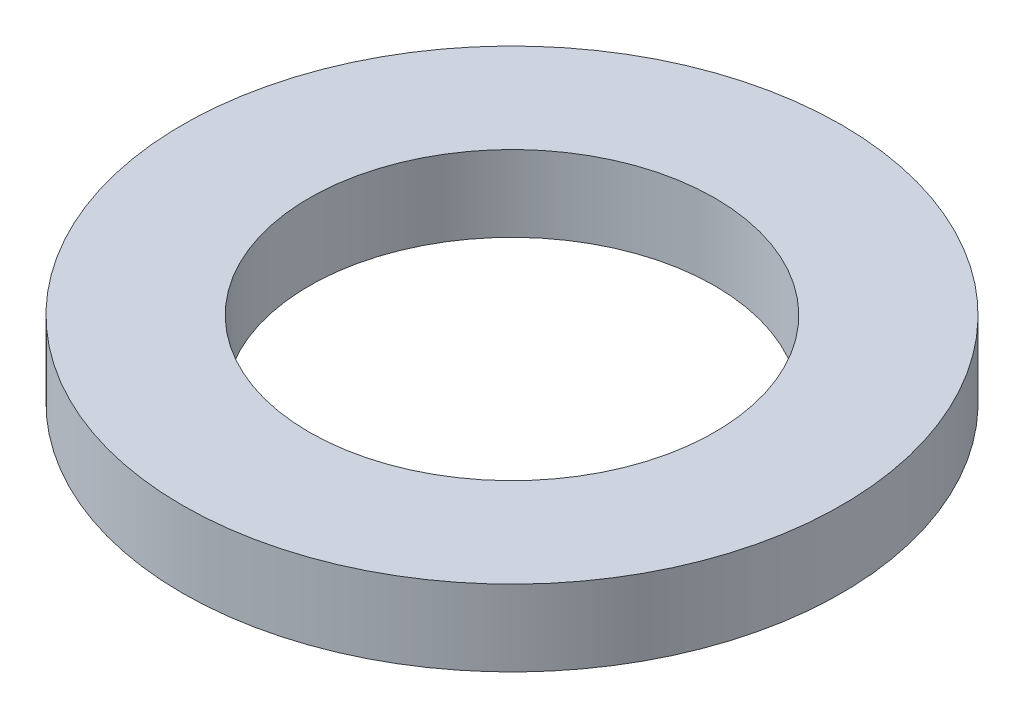
from build123d import *

# Parameters (mm, degrees)
SKETCH1_R           = 65
BOSS_EXTRUDE1_DEPTH = 15
SKETCH2_R           = 40
CUT_EXTRUDE1_DEPTH  = 94.139680051


with BuildPart() as part:
    # Sketch1 → Boss-Extrude1 (new body)
    with BuildSketch(Plane(origin=(0, 0, 0), x_dir=(1, 0, 0), z_dir=(0, 1, 0))):
        Circle(SKETCH1_R)
    extrude(amount=BOSS_EXTRUDE1_DEPTH)

    # Sketch2 → Cut-Extrude1 (cut, through all)
    with BuildSketch(Plane(origin=(0, 0, 0), x_dir=(1, 0, 0), z_dir=(0, 1, 0))):
        Circle(SKETCH2_R)
    extrude(amount=CUT_EXTRUDE1_DEPTH, mode=Mode.SUBTRACT)


solid = part.part
